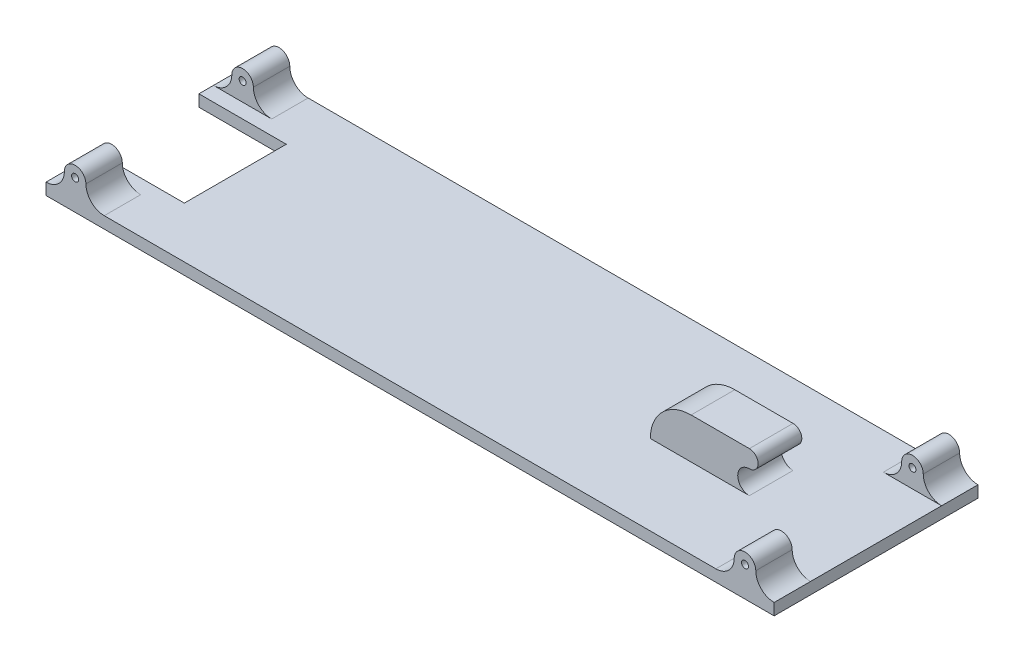
from build123d import *

# Parameters (mm, degrees)
SKETCH1_R           = 1.2
BOSS_EXTRUDE1_DEPTH = 35
SKETCH2_W           = 45
SKETCH2_H           = 10
CUT_EXTRUDE1_DEPTH  = 253.826027141
BOSS_EXTRUDE2_DEPTH = 7.5
SKETCH4_W           = 30
SKETCH4_H           = 35
CUT_EXTRUDE2_DEPTH  = 253.826027141


with BuildPart() as part:
    # Sketch1 → Boss-Extrude1 (new, symmetric)
    with BuildSketch(Plane.XY):
        with BuildLine():
            Line((0, 0), (250, 0))
            Line((250, 0), (250, 4))
            ThreePointArc((250, 4), (245.545227279, 5.845227279), (243.7, 10.3))
            ThreePointArc((243.7, 10.3), (240, 14), (236.3, 10.3))
            ThreePointArc((236.3, 10.3), (234.454772721, 5.845227279), (230, 4))
            Line((230, 4), (20, 4))
            ThreePointArc((20, 4), (15.545227279, 5.845227279), (13.7, 10.3))
            ThreePointArc((13.7, 10.3), (10, 14), (6.3, 10.3))
            ThreePointArc((6.3, 10.3), (4.454772721, 5.845227279), (0, 4))
            Line((0, 4), (0, 0))
        make_face()
        with Locations((10, 10.3)):
            Circle(SKETCH1_R, mode=Mode.SUBTRACT)
        with Locations((240, 10.3)):
            Circle(SKETCH1_R, mode=Mode.SUBTRACT)
    extrude(amount=BOSS_EXTRUDE1_DEPTH, both=True)

    # Sketch2 → Cut-Extrude1 (cut, through all)
    with BuildSketch(Plane(origin=(0, 0, 0), x_dir=(0, 0, -1), z_dir=(1, 0, 0))):
        with Locations((0, 9)):
            Rectangle(SKETCH2_W, SKETCH2_H)
    extrude(amount=CUT_EXTRUDE1_DEPTH, mode=Mode.SUBTRACT)

    # Sketch3 → Boss-Extrude2 (add, symmetric)
    with BuildSketch(Plane.XY):
        with BuildLine():
            Line((214, 18), (194, 18))
            ThreePointArc((194, 18), (184.100505063, 13.899494937), (180, 4))
            Line((180, 4), (214, 4))
            ThreePointArc((214, 4), (210, 8), (214, 12))
            ThreePointArc((214, 12), (217, 15), (214, 18))
        make_face()
    extrude(amount=BOSS_EXTRUDE2_DEPTH, both=True)

    # Sketch4 → Cut-Extrude2 (cut, through all)
    with BuildSketch(Plane(origin=(0, 4, 0), x_dir=(1, 0, 0), z_dir=(0, 1, 0))):
        with Locations((15, 0)):
            Rectangle(SKETCH4_W, SKETCH4_H)
    extrude(amount=-CUT_EXTRUDE2_DEPTH, mode=Mode.SUBTRACT)


solid = part.part
